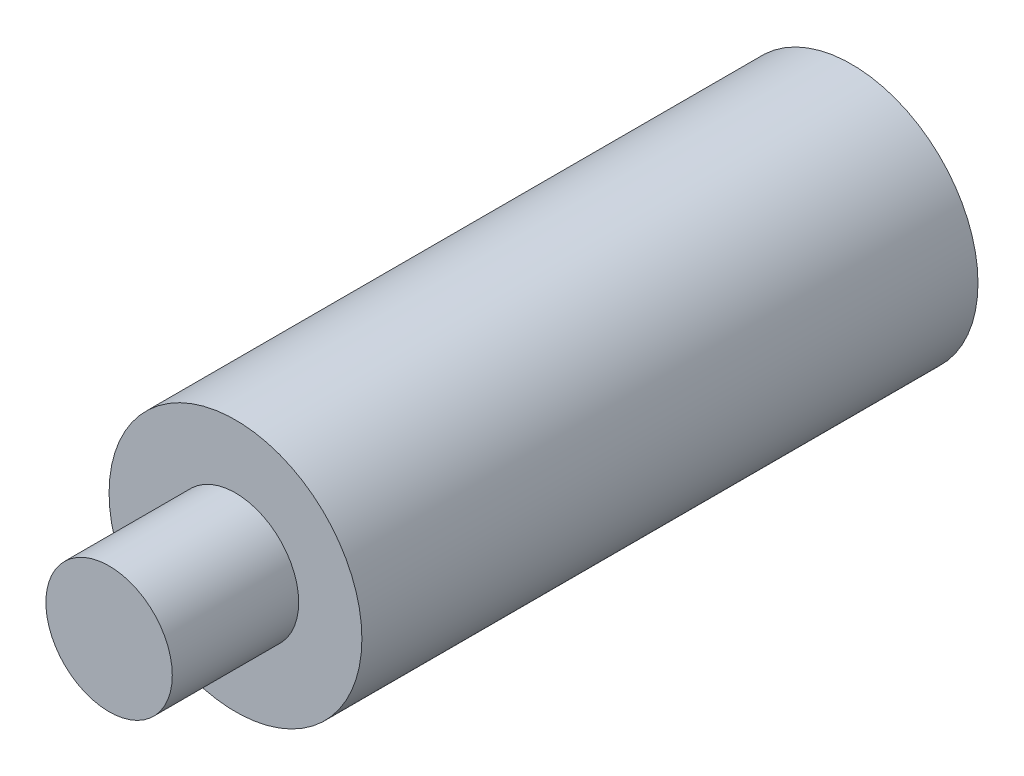
from build123d import *

# Parameters (mm, degrees)
SKETCH2_R                       = 6.35
BOSS_EXTRUDE1_DEPTH             = 30.9499
TAP_DRILL_FOR_1_4_20_TAP1_D     = 5.1054
TAP_DRILL_FOR_1_4_20_TAP1_DEPTH = 12.7
TAP_DRILL_FOR_1_4_20_TAP1_TIP   = 1.533816902
SKETCH6_R                       = 3.175
BOSS_EXTRUDE2_DEPTH             = 6.35


with BuildPart() as part:
    # Sketch2 → Boss-Extrude1 (new body)
    with BuildSketch(Plane(origin=(0, 0, 0), x_dir=(0, 1, 0), z_dir=(0, 0, 1))):
        Circle(SKETCH2_R)
    extrude(amount=BOSS_EXTRUDE1_DEPTH)

    # Tap Drill for 1/4-20 Tap1
    with Locations(Plane(origin=(0, 0, 0), x_dir=(-1, 0, 0), z_dir=(0, 0, -1))):
        with Locations((0, 0)):
            Hole(TAP_DRILL_FOR_1_4_20_TAP1_D / 2, depth=TAP_DRILL_FOR_1_4_20_TAP1_DEPTH)
            with Locations((0, 0, -(TAP_DRILL_FOR_1_4_20_TAP1_DEPTH + TAP_DRILL_FOR_1_4_20_TAP1_TIP / 2))):  # 118° drill point
                Cone(0, TAP_DRILL_FOR_1_4_20_TAP1_D / 2, TAP_DRILL_FOR_1_4_20_TAP1_TIP, mode=Mode.SUBTRACT)

    # Sketch6 → Boss-Extrude2 (add)
    with BuildSketch(Plane.XY.offset(30.9499)):
        Circle(SKETCH6_R)
    extrude(amount=BOSS_EXTRUDE2_DEPTH)


solid = part.part
